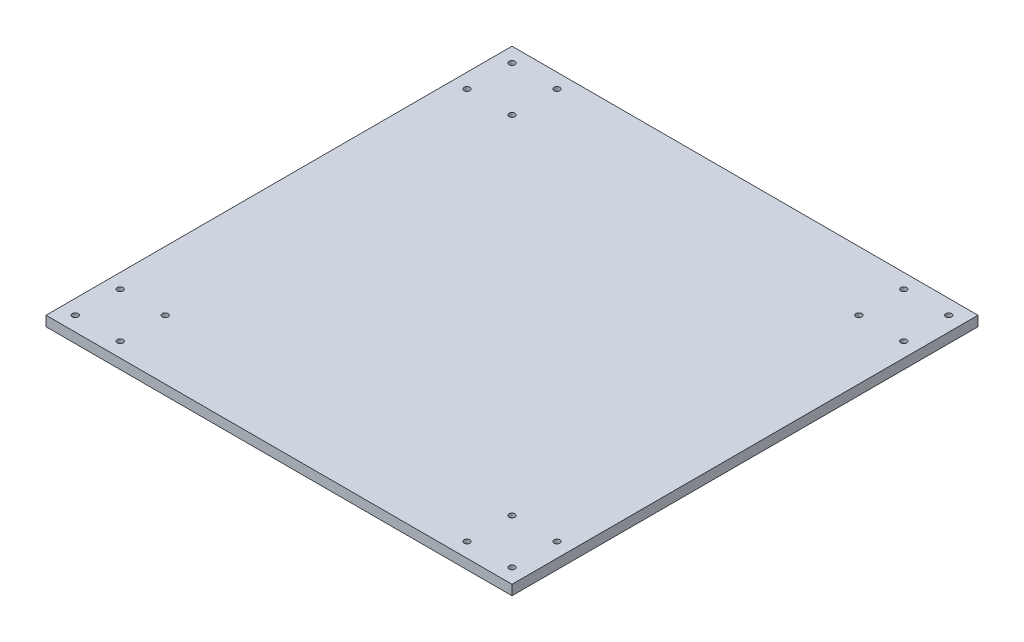
from build123d import *

# Parameters (mm, degrees)
SKETCH1_W           = 279.4
SKETCH1_H           = 279.4
SKETCH1_R           = 1.778
BOSS_EXTRUDE1_DEPTH = 5.9944


with BuildPart() as part:
    # Sketch1 → Boss-Extrude1 (new body)
    with BuildSketch(Plane(origin=(0, 0, 0), x_dir=(1, 0, 0), z_dir=(0, 1, 0))):
        Rectangle(SKETCH1_W, SKETCH1_H)
        with Locations((-130.9497, -130.9497)):
            Circle(SKETCH1_R, mode=Mode.SUBTRACT)
        with Locations((-104.0003, -130.9497)):
            Circle(SKETCH1_R, mode=Mode.SUBTRACT)
        with Locations((-130.9497, -104.0003)):
            Circle(SKETCH1_R, mode=Mode.SUBTRACT)
        with Locations((-104.0003, -104.0003)):
            Circle(SKETCH1_R, mode=Mode.SUBTRACT)
        with Locations((104.0003, -130.9497)):
            Circle(SKETCH1_R, mode=Mode.SUBTRACT)
        with Locations((130.9497, -130.9497)):
            Circle(SKETCH1_R, mode=Mode.SUBTRACT)
        with Locations((104.0003, -104.0003)):
            Circle(SKETCH1_R, mode=Mode.SUBTRACT)
        with Locations((130.9497, -104.0003)):
            Circle(SKETCH1_R, mode=Mode.SUBTRACT)
        with Locations((104.0003, 104.0003)):
            Circle(SKETCH1_R, mode=Mode.SUBTRACT)
        with Locations((130.9497, 104.0003)):
            Circle(SKETCH1_R, mode=Mode.SUBTRACT)
        with Locations((104.0003, 130.9497)):
            Circle(SKETCH1_R, mode=Mode.SUBTRACT)
        with Locations((130.9497, 130.9497)):
            Circle(SKETCH1_R, mode=Mode.SUBTRACT)
        with Locations((-130.9497, 104.0003)):
            Circle(SKETCH1_R, mode=Mode.SUBTRACT)
        with Locations((-104.0003, 104.0003)):
            Circle(SKETCH1_R, mode=Mode.SUBTRACT)
        with Locations((-130.9497, 130.9497)):
            Circle(SKETCH1_R, mode=Mode.SUBTRACT)
        with Locations((-104.0003, 130.9497)):
            Circle(SKETCH1_R, mode=Mode.SUBTRACT)
    extrude(amount=BOSS_EXTRUDE1_DEPTH)


solid = part.part
